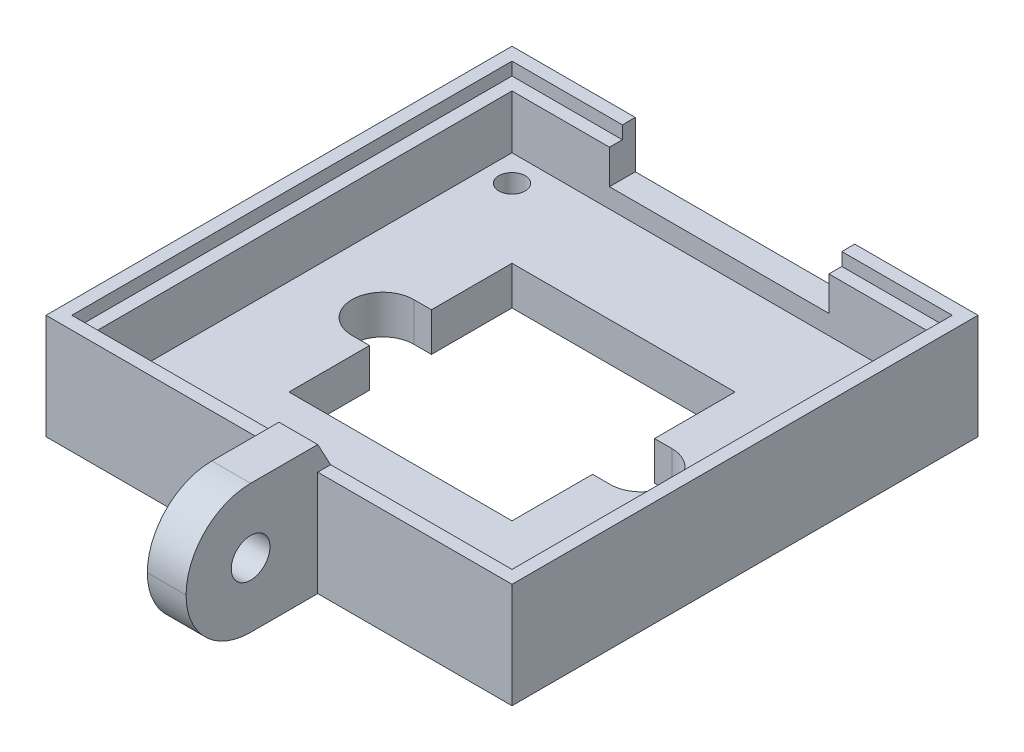
from build123d import *

# Parameters (mm, degrees)
SKETCH1_W           = 36.1
SKETCH1_H           = 36.1
SKETCH1_R           = 1.025
BOSS_EXTRUDE1_DEPTH = 3
SKETCH1_3_W         = 36.1
SKETCH1_3_H         = 36.1
SKETCH1_3_W_2       = 32.1
SKETCH1_3_H_2       = 32.1
BOSS_EXTRUDE2_DEPTH = 8.15
SKETCH2_W           = 17
SKETCH2_H           = 3.65
CUT_EXTRUDE1_DEPTH  = 6
CUT_EXTRUDE2_DEPTH  = 1
SKETCH6_W           = 3
SKETCH6_H           = 10
BOSS_EXTRUDE3_DEPTH = 10.2
FILLET1_R           = 5
SKETCH7_R           = 1.5
CUT_EXTRUDE3_DEPTH  = 10
CHAMFER1_SIZE2      = 1
CHAMFER1_SIZE       = 1.85


with BuildPart() as part:
    # Sketch1 → Boss-Extrude1 (new body)
    with BuildSketch(Plane(origin=(0, 0, 0), x_dir=(1, 0, 0), z_dir=(0, 1, 0))):
        Rectangle(SKETCH1_W, SKETCH1_H)
        with Locations(Location((-14, 14, 0), (0, 0, 270))):
            Circle(SKETCH1_R, mode=Mode.SUBTRACT)
        with Locations(Location((14, 14, 0), (0, 0, 270))):
            Circle(SKETCH1_R, mode=Mode.SUBTRACT)
        with Locations(Location((14, -14, 0), (0, 0, 270))):
            Circle(SKETCH1_R, mode=Mode.SUBTRACT)
        with Locations(Location((-14, -14, 0), (0, 0, 270))):
            Circle(SKETCH1_R, mode=Mode.SUBTRACT)
        with BuildLine():
            Line((-8.64, 2.4), (-8.64, 8.64))
            Line((-8.64, 8.64), (8.64, 8.64))
            Line((8.64, 8.64), (8.64, 2.4))
            Line((8.64, 2.4), (10, 2.4))
            ThreePointArc((10, 2.4), (12.4, 0), (10, -2.4))
            Line((10, -2.4), (8.64, -2.4))
            Line((8.64, -2.4), (8.64, -8.64))
            Line((8.64, -8.64), (-8.64, -8.64))
            Line((-8.64, -8.64), (-8.64, -2.4))
            Line((-8.64, -2.4), (-10, -2.4))
            ThreePointArc((-10, -2.4), (-12.4, 0), (-10, 2.4))
            Line((-10, 2.4), (-8.64, 2.4))
        make_face(mode=Mode.SUBTRACT)
    extrude(amount=BOSS_EXTRUDE1_DEPTH)

    # Sketch1<3> → Boss-Extrude2 (add)
    with BuildSketch(Plane(origin=(0, 0, 0), x_dir=(1, 0, 0), z_dir=(0, 1, 0))):
        Rectangle(SKETCH1_3_W, SKETCH1_3_H)
        Rectangle(SKETCH1_3_W_2, SKETCH1_3_H_2, mode=Mode.SUBTRACT)
    extrude(amount=BOSS_EXTRUDE2_DEPTH)

    # Sketch2 → Cut-Extrude1 (cut)
    with BuildSketch(Plane(origin=(0, 0, -18.05), x_dir=(-1, 0, 0), z_dir=(0, 0, -1))):
        with Locations((0, 6.325)):
            Rectangle(SKETCH2_W, SKETCH2_H)
    extrude(amount=-CUT_EXTRUDE1_DEPTH, mode=Mode.SUBTRACT)

    # Sketch4 → Cut-Extrude2 (cut)
    with BuildSketch(Plane(origin=(0, 8.15, 0), x_dir=(1, 0, 0), z_dir=(0, 1, 0))):
        Polygon((17.05, -17.05), (-17.05, -17.05), (-17.05, 17.05), (-8.5, 17.05), (-8.5, 16.05), (-16.05, 16.05), (-16.05, -16.05), (16.05, -16.05), (16.05, 16.05), (8.5, 16.05), (8.5, 17.05), (17.05, 17.05), align=None)
    extrude(amount=-CUT_EXTRUDE2_DEPTH, mode=Mode.SUBTRACT)

    # Sketch6 → Boss-Extrude3 (add)
    with BuildSketch(Plane.XY.offset(18.05)):
        with Locations((1.5, 5)):
            Rectangle(SKETCH6_W, SKETCH6_H)
    extrude(amount=BOSS_EXTRUDE3_DEPTH)

    # Fillet1
    fillet1_edges = [part.edges().sort_by_distance(p)[0] for p in [
        (1.5, 0, 28.25),
        (1.5, 10, 28.25),
    ]]
    fillet(fillet1_edges, radius=FILLET1_R - 0.0001)  # a hair under: the kernel refuses the full size

    # Sketch7 → Cut-Extrude3 (cut)
    with BuildSketch(Plane(origin=(3, 0, 0), x_dir=(0, 0, -1), z_dir=(1, 0, 0))):
        with Locations(Location((-23.25, 5, 0), (0, 0, 90))):
            Circle(SKETCH7_R)
    extrude(amount=-CUT_EXTRUDE3_DEPTH, mode=Mode.SUBTRACT)

    # Chamfer1
    chamfer1_edges = [part.edges().sort_by_distance(p)[0] for p in [
        (1.5, 8.15, 18.05),
    ]]
    chamfer1_side = [part.faces().sort_by_distance(p)[0] for p in [
        (1.5, 8.17, 18.05),
    ]]
    chamfer(chamfer1_edges, length=CHAMFER1_SIZE - 0.0001, length2=CHAMFER1_SIZE2 - 0.0001, reference=chamfer1_side[0])  # a hair under: the kernel refuses the full size


solid = part.part
